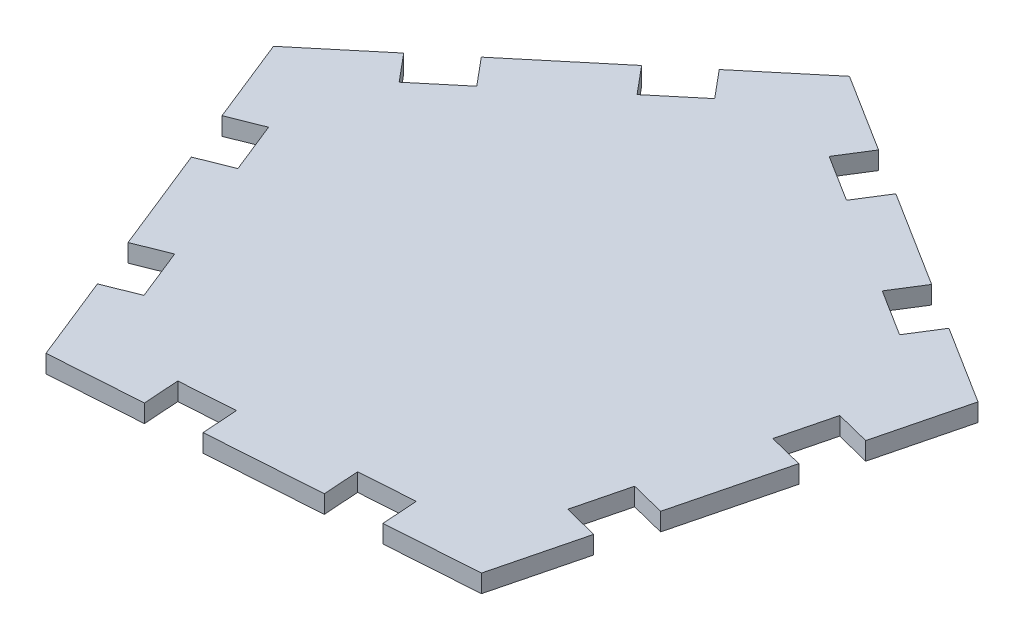
from build123d import *

# Parameters (mm, degrees)
BOSS_EXTRUDE1_DEPTH = 3.18
CUT_F_DEPTH         = 87.044973388
CIRCLE_F_COUNT      = 5


with BuildPart() as part:
    # Sketch1 → Boss-Extrude1 (new body)
    with BuildSketch(Plane(origin=(0, 0, 0), x_dir=(1, 0, 0), z_dir=(0, 1, 0))):
        Polygon((-59.925822748, 15.118064705), (-32.896231583, -52.321105303), (39.594833528, -47.454286112), (57.367184482, 22.992743574), (-4.139963679, 61.664583135), align=None)
    extrude(amount=BOSS_EXTRUDE1_DEPTH)

    # Sketch2 → Cut F (cut, through all)
    with BuildSketch(Plane.XZ):
        Polygon((-53.814432245, 0.129931487), (-47.910949589, -2.236181895), (-44.268771915, 6.851097224), (-50.17225457, 9.217210606), align=None)
        Polygon((-42.649799761, 27.985829992), (-39.007622087, 37.073109111), (-33.104139431, 34.706995729), (-36.746317106, 25.61971661), align=None)
    cut_f = extrude(amount=-CUT_F_DEPTH, mode=Mode.SUBTRACT)

    # Circle F: Cut F ×5 about axis
    circle_f_axis = Axis((0, 3.339, 0), (0, -1, 0))
    for i in range(1, CIRCLE_F_COUNT):
        add(cut_f.rotate(circle_f_axis, i * 360 / CIRCLE_F_COUNT), mode=Mode.SUBTRACT)


solid = part.part
